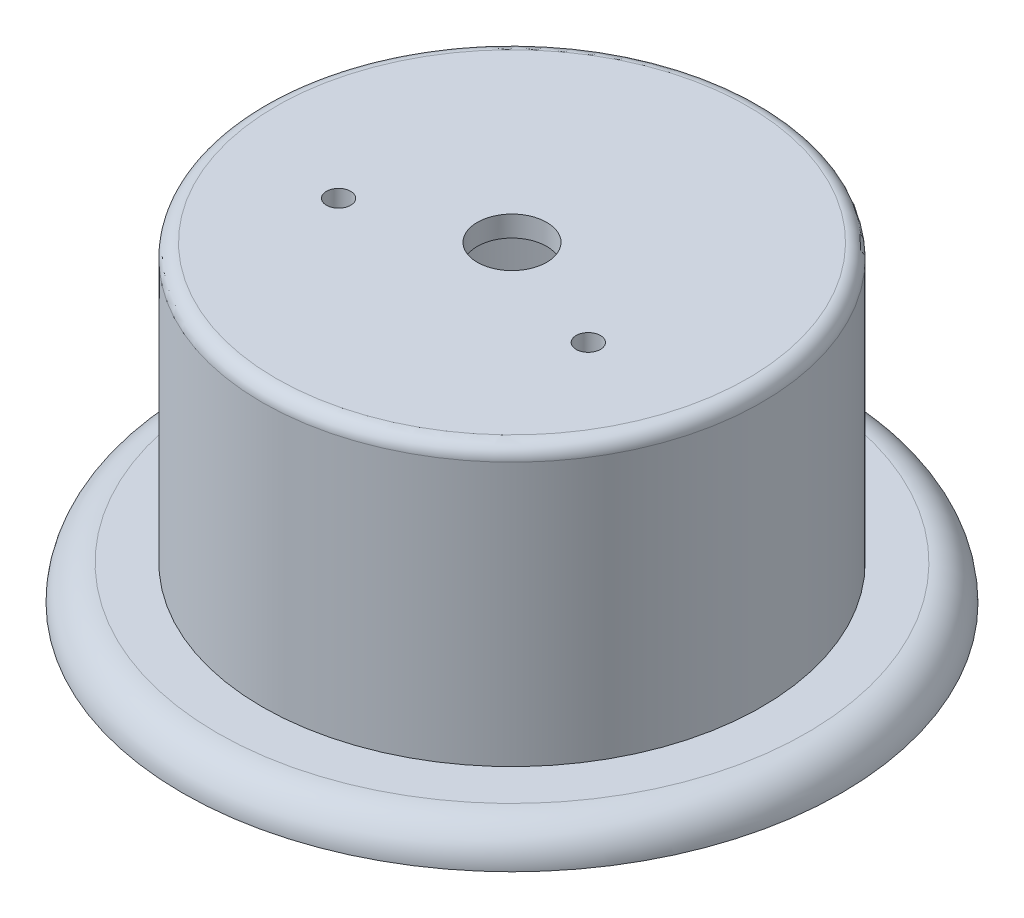
from build123d import *

# Parameters (mm, degrees)
SKETCH1_R           = 47.5
BOSS_EXTRUDE1_DEPTH = 5
SKETCH2_R           = 36
BOSS_EXTRUDE2_DEPTH = 40
SKETCH3_R           = 34.5
CUT_EXTRUDE1_DEPTH  = 42
SKETCH4_R           = 5
CUT_EXTRUDE2_DEPTH  = 5
FILLET1_R           = 5
SKETCH5_R           = 1.75
CUT_EXTRUDE3_DEPTH  = 5
FILLET2_R           = 2


with BuildPart() as part:
    # Sketch1 → Boss-Extrude1 (new body)
    with BuildSketch(Plane(origin=(0, 0, 0), x_dir=(1, 0, 0), z_dir=(0, 1, 0))):
        with Locations(Location((0, 0, 0), (0, 0, 270))):
            Circle(SKETCH1_R)
    extrude(amount=BOSS_EXTRUDE1_DEPTH)

    # Sketch2 → Boss-Extrude2 (add)
    with BuildSketch(Plane(origin=(0, 5, 0), x_dir=(1, 0, 0), z_dir=(0, 1, 0))):
        with Locations(Location((0, 0, 0), (0, 0, 270))):
            Circle(SKETCH2_R)
    extrude(amount=BOSS_EXTRUDE2_DEPTH)

    # Sketch3 → Cut-Extrude1 (cut)
    with BuildSketch(Plane.XZ):
        with Locations(Location((0, 0, 0), (0, 0, 270))):
            Circle(SKETCH3_R)
    extrude(amount=-CUT_EXTRUDE1_DEPTH, mode=Mode.SUBTRACT)

    # Sketch4 → Cut-Extrude2 (cut)
    with BuildSketch(Plane(origin=(0, 45, 0), x_dir=(1, 0, 0), z_dir=(0, 1, 0))):
        with Locations(Location((0, 0, 0), (0, 0, 270))):
            Circle(SKETCH4_R)
    extrude(amount=-CUT_EXTRUDE2_DEPTH, mode=Mode.SUBTRACT)

    # Fillet1
    fillet1_edges = [part.edges().sort_by_distance(p)[0] for p in [
        (0, 5, -47.5),
    ]]
    fillet(fillet1_edges, radius=FILLET1_R - 0.0001)  # a hair under: the kernel refuses the full size

    # Sketch5 → Cut-Extrude3 (cut)
    with BuildSketch(Plane(origin=(0, 45, 0), x_dir=(1, 0, 0), z_dir=(0, 1, 0))):
        with Locations(Location((18, -7, 0), (0, 0, 270))):
            Circle(SKETCH5_R)
        with Locations(Location((-18, -7, 0), (0, 0, 270))):
            Circle(SKETCH5_R)
    extrude(amount=-CUT_EXTRUDE3_DEPTH, mode=Mode.SUBTRACT)

    # Fillet2
    fillet2_edges = [part.edges().sort_by_distance(p)[0] for p in [
        (0, 45, -36),
    ]]
    fillet(fillet2_edges, radius=FILLET2_R)


solid = part.part
